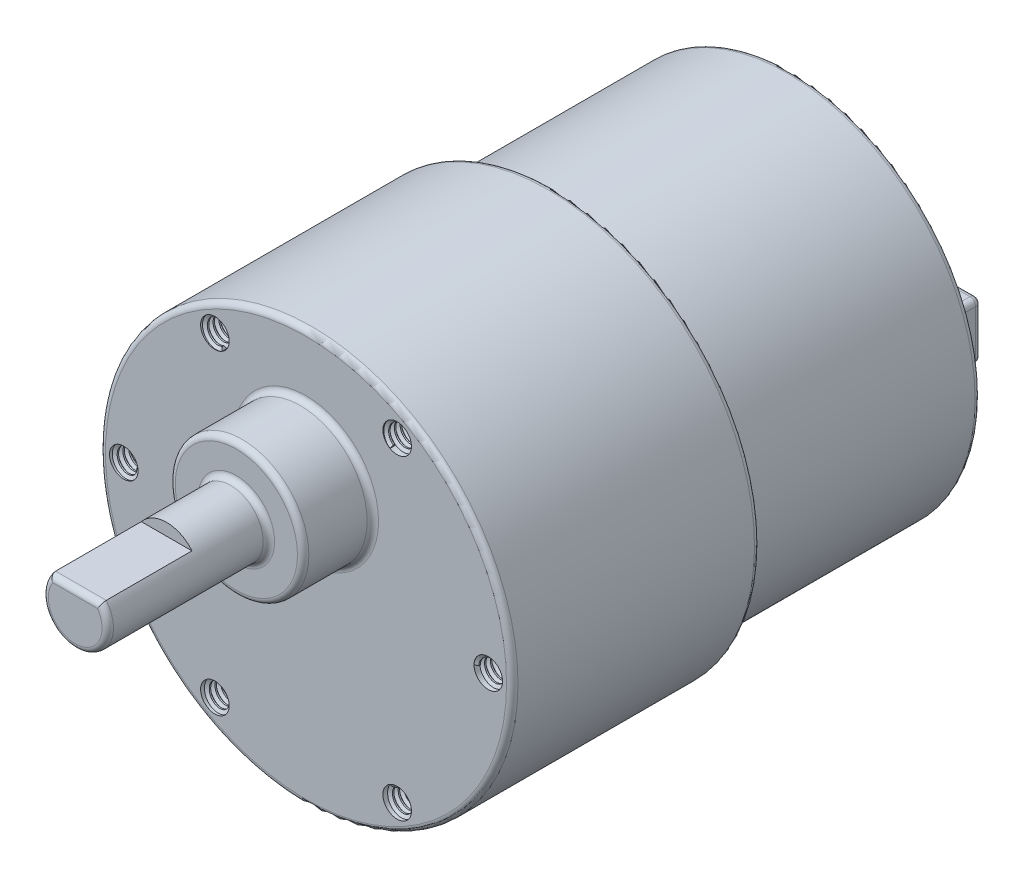
from build123d import *
from build123d.topology import SkipClean

# Parameters (mm, degrees)
SKETCH1_R           = 16.45
BOSS_EXTRUDE1_DEPTH = 20.9
SKETCH2_R           = 18.05
BOSS_EXTRUDE2_DEPTH = 21.7
SKETCH3_R           = 3.7
BOSS_EXTRUDE3_DEPTH = 2.9
SKETCH4_W           = 3
SKETCH4_H           = 5
BOSS_EXTRUDE4_DEPTH = 5
SKETCH5_R           = 5.85
BOSS_EXTRUDE5_DEPTH = 6.1
SKETCH6_R           = 2.85
BOSS_EXTRUDE6_DEPTH = 14.1
CUT_EXTRUDE1_START  = -8
CUT_EXTRUDE1_DEPTH  = 8
FILLET1_R           = 0.5
SKETCH8_R           = 1.25
CUT_EXTRUDE2_DEPTH  = 4
THREAD1_PITCH       = 0.5
CIRPATTERN1_COUNT   = 6


with BuildPart() as part:
    # Sketch1 → Boss-Extrude1 (new body)
    with BuildSketch(Plane.XY):
        Circle(SKETCH1_R)
    extrude(amount=BOSS_EXTRUDE1_DEPTH)

    # Sketch2 → Boss-Extrude2 (add)
    with BuildSketch(Plane.XY.offset(20.9)):
        Circle(SKETCH2_R)
    extrude(amount=BOSS_EXTRUDE2_DEPTH)

    # Sketch3 → Boss-Extrude3 (add)
    with BuildSketch(Plane(origin=(0, 0, 0), x_dir=(-1, 0, 0), z_dir=(0, 0, -1))):
        Circle(SKETCH3_R)
    extrude(amount=BOSS_EXTRUDE3_DEPTH)

    # Sketch4 → Boss-Extrude4 (add)
    with BuildSketch(Plane(origin=(0, 0, 0), x_dir=(-1, 0, 0), z_dir=(0, 0, -1))):
        with Locations((-10, 0)):
            Rectangle(SKETCH4_W, SKETCH4_H)
        with Locations((10, 0)):
            Rectangle(SKETCH4_W, SKETCH4_H)
    extrude(amount=BOSS_EXTRUDE4_DEPTH)

    # Sketch5 → Boss-Extrude5 (add)
    with BuildSketch(Plane.XY.offset(42.6)):
        with Locations((0, 6.7)):
            Circle(SKETCH5_R)
    extrude(amount=BOSS_EXTRUDE5_DEPTH)

    # Sketch6 → Boss-Extrude6 (add)
    with BuildSketch(Plane.XY.offset(48.7)):
        with Locations((0, 6.7)):
            Circle(SKETCH6_R)
    extrude(amount=BOSS_EXTRUDE6_DEPTH)

    # Sketch7 → Cut-Extrude1 (cut)
    with BuildSketch(Plane.XY.offset(62.8).offset(CUT_EXTRUDE1_START)):
        with BuildLine():
            Line((-2.214384001, 8.494158158), (2.214384001, 8.494158158))
            ThreePointArc((2.214384001, 8.494158158), (0, 9.55), (-2.214384001, 8.494158158))
        make_face()
    extrude(amount=CUT_EXTRUDE1_DEPTH, mode=Mode.SUBTRACT)

    # Fillet1
    fillet1_edges = [part.edges().sort_by_distance(p)[0] for p in [
        (3.7, 0, 0),
        (3.7, 0, -2.9),
        (8.5, 0, 0),
        (8.5, -2.5, -2.5),
        (10, 2.5, 0),
        (8.5, 2.5, -2.5),
        (11.5, 0, 0),
        (11.5, 2.5, -2.5),
        (10, -2.5, 0),
        (11.5, -2.5, -2.5),
        (8.5, 0, -5),
        (10, 2.5, -5),
        (11.5, 0, -5),
        (-16.45, 0, 0),
        (10, -2.5, -5),
        (-11.5, 0, 0),
        (-11.5, -2.5, -2.5),
        (-10, 2.5, 0),
        (-11.5, 2.5, -2.5),
        (-8.5, 0, 0),
        (-8.5, 2.5, -2.5),
        (-10, -2.5, 0),
        (-8.5, -2.5, -2.5),
        (-11.5, 0, -5),
        (-10, 2.5, -5),
        (-8.5, 0, -5),
        (-10, -2.5, -5),
        (-5.85, 6.7, 42.6),
        (-5.85, 6.7, 48.7),
        (-2.85, 6.7, 48.7),
        (-16.45, 0, 20.9),
        (-0.951710459, 4.013599583, 62.8),
        (0, 8.494158158, 62.8),
        (-18.05, 0, 20.9),
        (-18.05, 0, 42.6),
    ]]
    fillet(fillet1_edges, radius=FILLET1_R)

    # Sketch8 → Cut-Extrude2 (cut)
    with BuildSketch(Plane.XY.offset(42.6)):
        with Locations((15.95, 0)):
            Circle(SKETCH8_R)
        with Locations((7.975, -13.81310519)):
            Circle(SKETCH8_R)
        with Locations((-7.975, -13.81310519)):
            Circle(SKETCH8_R)
        with Locations((-15.95, 0)):
            Circle(SKETCH8_R)
        with Locations((-7.975, 13.81310519)):
            Circle(SKETCH8_R)
        with Locations((7.975, 13.81310519)):
            Circle(SKETCH8_R)
    extrude(amount=-CUT_EXTRUDE2_DEPTH, mode=Mode.SUBTRACT)

    # Thread1: arcs per turn and ends read off the stored shape
    # Thread1: the profile of Thread Profile1 profile screwed along a right-hand helix through 8 turns, 6 arcs to a turn; built about Z, then put on its axis
    with SkipClean():  # the faces are left unmerged after this step: merging them gives an invalid solid
        thread1_z = Axis((0, 0, 0), (0, 0, 1))
        thread1_corners = [(1.2503, 0, -0.000173205), (1.2503, 0, 0.437673204), (0.979367062, 0, 0.281249999), (0.979367062, 0, 0.156249999)]
        with BuildLine(mode=Mode.PRIVATE) as thread1_profile:
            Line(thread1_corners[0], thread1_corners[1])
            Line(thread1_corners[1], thread1_corners[2])
            Line(thread1_corners[2], thread1_corners[3])
            Line(thread1_corners[3], thread1_corners[0])
        thread1_cap = Face(thread1_profile.wire())
        thread1_turn_angles = [0, 30, 60, 90, 120, 150, 180, 210, 240, 270, 300, 330, 360]
        thread1_turn_weights = [1, 0.8660254037844387, 1, 0.8660254037844387, 1, 0.8660254037844387, 1, 0.8660254037844387, 1, 0.8660254037844387, 1, 0.8660254037844387, 1]
        thread1_turn_rails = [Edge.make_bspline([Vector(p[0], p[1], 0).rotate(thread1_z, thread1_turn_angles[k]) / thread1_turn_weights[k] + Vector(0, 0, p[2] + THREAD1_PITCH * thread1_turn_angles[k] / 360) for k in range(13)], [0, 0, 0, 1, 1, 2, 2, 3, 3, 4, 4, 5, 5, 6, 6, 6], 2, thread1_turn_weights) for p in thread1_corners]
        thread1_turn_sides = [Face.make_surface_from_curves(thread1_turn_rails[p[0]], thread1_turn_rails[p[1]]) for p in [(0, 1), (1, 2), (2, 3), (3, 0)]]
        thread1 = Plane(origin=(15.95, 0, 42.6), x_dir=(-1, 0, 0), z_dir=(0, 0, -1)) * Solid(Shell([*[p.moved(Location((0, 0, THREAD1_PITCH * i))) for i in range(8) for p in thread1_turn_sides], thread1_cap, thread1_cap.rotate(thread1_z, 2880).moved(Location((0, 0, THREAD1_PITCH * 2880 / 360)))]))
        add(thread1)

    # CirPattern1: Thread1 ×6 about axis
    with SkipClean():  # the faces are left unmerged after this step: merging them gives an invalid solid
        cirpattern1_axis = Axis((0, 0, 42.6), (0, 0, -1))
        for i in range(1, CIRPATTERN1_COUNT):
            add(thread1.rotate(cirpattern1_axis, i * 360 / CIRPATTERN1_COUNT))


solid = part.part
